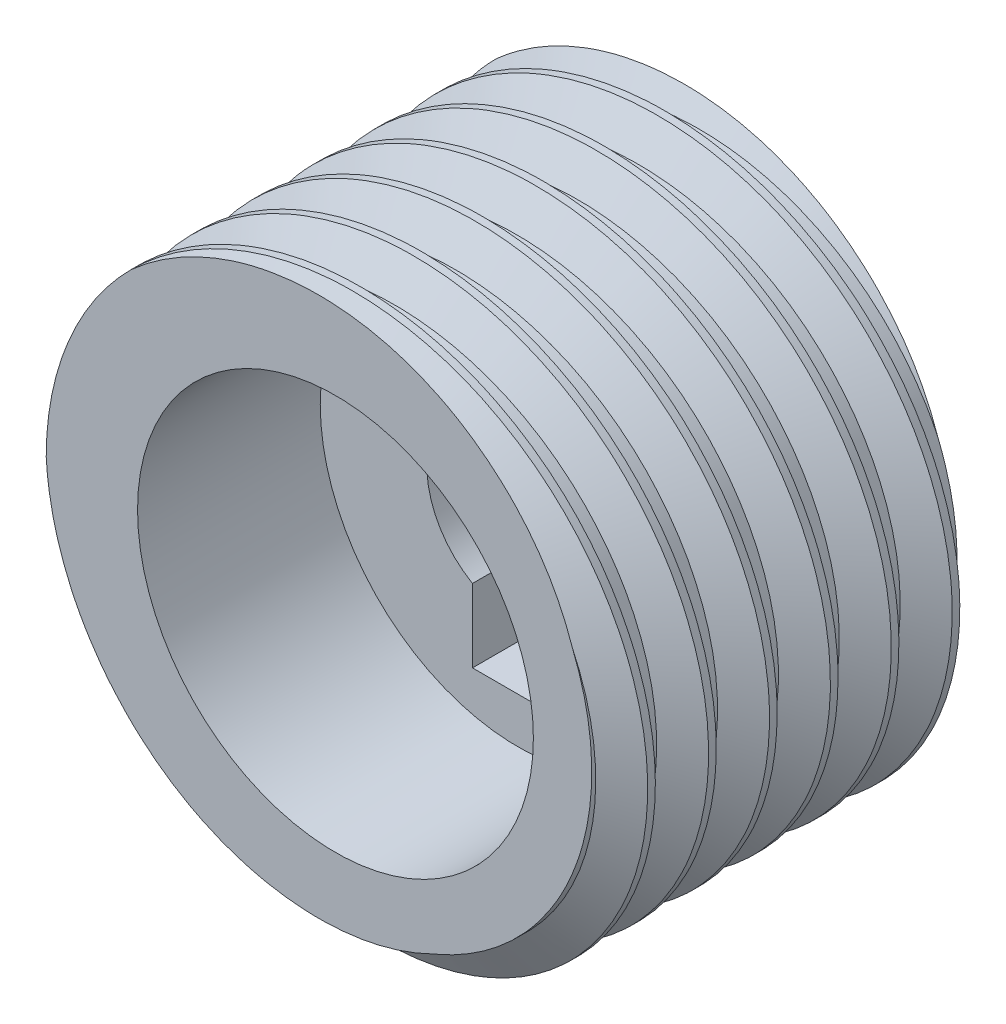
from build123d import *

# Parameters (mm, degrees)
SKETCH2_R           = 4.75
BOSS_EXTRUDE1_DEPTH = 6
SKETCH5_R           = 3.25
CUT_EXTRUDE1_DEPTH  = 3
THREAD1_PITCH       = 1
SKETCH11_W          = 1.5
SKETCH11_H          = 5
CUT_EXTRUDE2_DEPTH  = 3
SKETCH12_R          = 1.5
CUT_EXTRUDE3_DEPTH  = 8.356969655


with BuildPart() as part:
    # Sketch2 → Boss-Extrude1 (new body)
    with BuildSketch(Plane.XY):
        Circle(SKETCH2_R)
    extrude(amount=-BOSS_EXTRUDE1_DEPTH)

    # Sketch5 → Cut-Extrude1 (cut)
    with BuildSketch(Plane.XY):
        Circle(SKETCH5_R)
    extrude(amount=-CUT_EXTRUDE1_DEPTH, mode=Mode.SUBTRACT)

    # Thread1: the profile of Thread Profile1 profile screwed along a right-hand helix of 7 turns, 8 arcs to a turn; built about Z, then put on its axis
    thread1_z = Axis((0, 0, 0), (0, 0, 1))
    thread1_corners = [(4.7503, 0, -0.000173205), (4.7503, 0, 0.875173202), (4.208734125, 0, 0.562499999), (4.208734125, 0, 0.312499999)]
    with BuildLine(mode=Mode.PRIVATE) as thread1_profile:
        Line(thread1_corners[0], thread1_corners[1])
        Line(thread1_corners[1], thread1_corners[2])
        Line(thread1_corners[2], thread1_corners[3])
        Line(thread1_corners[3], thread1_corners[0])
    thread1_cap = Face(thread1_profile.wire())
    thread1_turn_angles = [0, 22.5, 45, 67.5, 90, 112.5, 135, 157.5, 180, 202.5, 225, 247.5, 270, 292.5, 315, 337.5, 360]
    thread1_turn_weights = [1, 0.9238795325112867, 1, 0.9238795325112867, 1, 0.9238795325112867, 1, 0.9238795325112867, 1, 0.9238795325112867, 1, 0.9238795325112867, 1, 0.9238795325112867, 1, 0.9238795325112867, 1]
    thread1_turn_rails = [Edge.make_bspline([Vector(p[0], p[1], 0).rotate(thread1_z, thread1_turn_angles[k]) / thread1_turn_weights[k] + Vector(0, 0, p[2] + THREAD1_PITCH * thread1_turn_angles[k] / 360) for k in range(17)], [0, 0, 0, 1, 1, 2, 2, 3, 3, 4, 4, 5, 5, 6, 6, 7, 7, 8, 8, 8], 2, thread1_turn_weights) for p in thread1_corners]
    thread1_turn_sides = [Face.make_surface_from_curves(thread1_turn_rails[p[0]], thread1_turn_rails[p[1]]) for p in [(0, 1), (1, 2), (2, 3), (3, 0)]]
    thread1 = Plane(origin=(0, 0, 1), x_dir=(-1, 0, 0), z_dir=(0, 0, -1)) * Solid(Shell([*[p.moved(Location((0, 0, THREAD1_PITCH * i))) for i in range(7) for p in thread1_turn_sides], thread1_cap, thread1_cap.rotate(thread1_z, 2520).moved(Location((0, 0, THREAD1_PITCH * 2520 / 360)))]))
    add(thread1, mode=Mode.SUBTRACT)

    # Sketch11 → Cut-Extrude2 (cut)
    with BuildSketch(Plane.XY.offset(-3)):
        Rectangle(SKETCH11_W, SKETCH11_H)
    extrude(amount=-CUT_EXTRUDE2_DEPTH, mode=Mode.SUBTRACT)

    # Sketch12 → Cut-Extrude3 (cut, through all)
    with BuildSketch(Plane.XY.offset(-3)):
        Circle(SKETCH12_R)
    extrude(amount=-CUT_EXTRUDE3_DEPTH, mode=Mode.SUBTRACT)


solid = part.part
